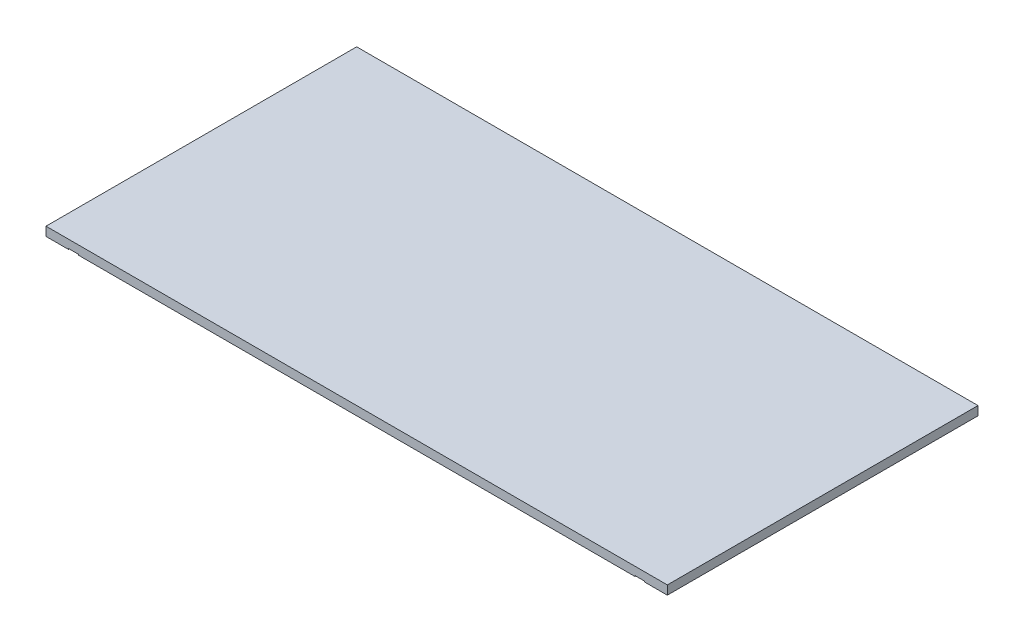
from build123d import *

# Parameters (mm, degrees)
SKETCH1_W           = 1219.2
SKETCH1_H           = 609.6
BOSS_EXTRUDE1_DEPTH = 17.4752
CUT_EXTRUDE1_DEPTH  = 1.5875


with BuildPart() as part:
    # Sketch1 → Boss-Extrude1 (new body)
    with BuildSketch(Plane(origin=(0, 0, 0), x_dir=(1, 0, 0), z_dir=(0, 1, 0))):
        Rectangle(SKETCH1_W, SKETCH1_H)
    extrude(amount=BOSS_EXTRUDE1_DEPTH)

    # Sketch2 → Cut-Extrude1 (cut)
    with BuildSketch(Plane(origin=(0, 0, 0), x_dir=(1, 0, 0), z_dir=(0, 1, 0))):
        Polygon((-565.15, 304.8), (-546.1, 304.8), (-546.1, 9.525), (101.6, 9.525), (101.6, 304.8), (120.65, 304.8), (120.65, 9.525), (546.1, 9.525), (546.1, 304.8), (565.15, 304.8), (565.15, -304.8), (546.1, -304.8), (546.1, -9.525), (120.65, -9.525), (101.6, -9.525), (-101.6, -9.525), (-120.65, -9.525), (-546.1, -9.525), (-546.1, -304.8), (-565.15, -304.8), align=None)
    extrude(amount=CUT_EXTRUDE1_DEPTH, mode=Mode.SUBTRACT)


solid = part.part
